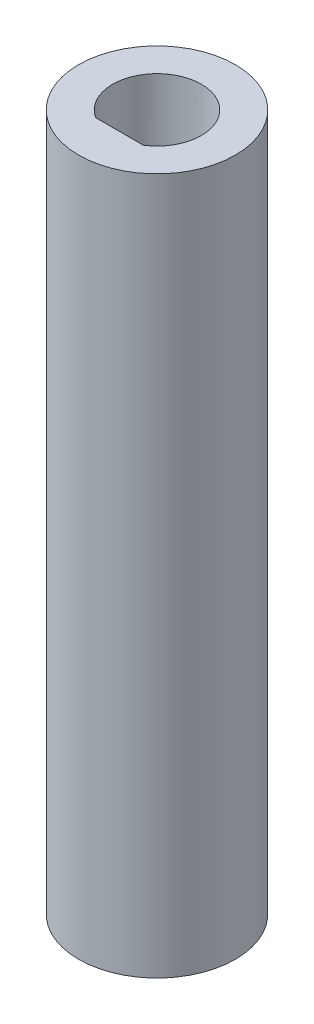
from build123d import *

# Parameters (mm, degrees)
SKETCH1_R           = 5.715
BOSS_EXTRUDE1_DEPTH = 12.7
BOSS_EXTRUDE2_START = 38.1
SKETCH3_R           = 5.715
BOSS_EXTRUDE2_DEPTH = 38.1
CUT_EXTRUDE1_DEPTH  = 38.1


with BuildPart() as part:
    # Sketch1 → Boss-Extrude1 (new body)
    with BuildSketch(Plane(origin=(0, 0, 0), x_dir=(1, 0, 0), z_dir=(0, 1, 0))):
        Circle(SKETCH1_R)
        with BuildLine():
            Line((1.741336269, -2.7305), (-1.741336269, -2.7305))
            ThreePointArc((-1.741336269, -2.7305), (0, 3.2385), (1.741336269, -2.7305))
        make_face(mode=Mode.SUBTRACT)
    extrude(amount=BOSS_EXTRUDE1_DEPTH)

    # Sketch3 → Boss-Extrude2 (add)
    with BuildSketch(Plane(origin=(0, 0, 0), x_dir=(-1, 0, 0), z_dir=(0, -1, 0)).offset(BOSS_EXTRUDE2_START)):
        Circle(SKETCH3_R)
    extrude(amount=-BOSS_EXTRUDE2_DEPTH)

    # Sketch4 → Cut-Extrude1 (cut)
    with BuildSketch(Plane.XZ.offset(38.1)):
        Polygon((0, 2.54), (-1.796051224, 4.336051224), (-4.336051224, 1.796051224), (-2.54, 0), (-4.336051224, -1.796051224), (-1.796051224, -4.336051224), (0, -2.54), (1.796051224, -4.336051224), (4.336051224, -1.796051224), (2.54, 0), (4.336051224, 1.796051224), (1.796051224, 4.336051224), align=None)
    extrude(amount=-CUT_EXTRUDE1_DEPTH, mode=Mode.SUBTRACT)


solid = part.part
